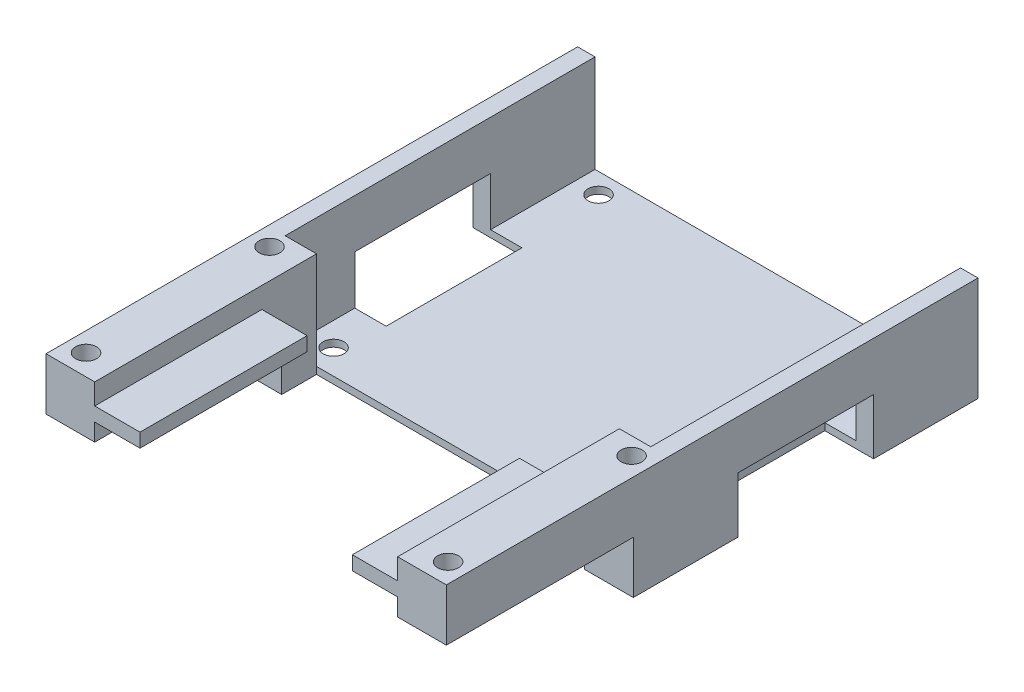
from build123d import *

# Parameters (mm, degrees)
SKETCH1_W                = 52.5
SKETCH1_H                = 44.5
BOSS_EXTRUDE1_DEPTH      = 1
BOSS_EXTRUDE2_DEPTH      = 15
F_3_0_3_DIAMETER_HOLE1_D = 3
SKETCH6_W                = 6.5
SKETCH6_H                = 2
BOSS_EXTRUDE3_DEPTH      = 24
SKETCH6_4_W              = 7
SKETCH6_4_H              = 7.5
CUT_EXTRUDE1_DEPTH       = 26.85
SKETCH8_W                = 7
SKETCH8_H                = 19.5
CUT_EXTRUDE2_DEPTH       = 8
CUT_EXTRUDE3_DEPTH       = 0.3


with BuildPart() as part:
    # Sketch1 → Boss-Extrude1 (new body)
    with BuildSketch(Plane(origin=(0, 0, 0), x_dir=(1, 0, 0), z_dir=(0, 1, 0))):
        with Locations((0, 54.1)):
            Rectangle(SKETCH1_W, SKETCH1_H)
    extrude(amount=BOSS_EXTRUDE1_DEPTH)

    # Sketch1<3> → Boss-Extrude2 (add)
    with BuildSketch(Plane(origin=(0, 0, 0), x_dir=(1, 0, 0), z_dir=(0, 1, 0))):
        Polygon((-26.25, 76.35), (-28.75, 76.35), (-28.75, 0), (-21.75, 0), (-21.75, 31.85), (-26.25, 31.85), align=None)
        Polygon((28.75, 76.35), (26.25, 76.35), (26.25, 31.85), (21.75, 31.85), (21.75, 0), (28.75, 0), align=None)
    extrude(amount=BOSS_EXTRUDE2_DEPTH)

    # Ø3.0 (3) Diameter Hole1 (through all)
    with Locations(Plane(origin=(0, 0, 0), x_dir=(-1, 0, 0), z_dir=(0, -1, 0))):
        with Locations((-22.85, 73.45), (22.85, 73.45), (26, 29.35), (22.85, 35.4), (-22.85, 35.4), (-26, 29.35), (-26, 3), (26, 3), (-30.25, 71.35), (30.25, 71.35)):
            Hole(F_3_0_3_DIAMETER_HOLE1_D / 2)

    # Sketch6 → Boss-Extrude3 (add)
    with BuildSketch(Plane.XY):
        with Locations((-18.5, 11)):
            Rectangle(SKETCH6_W, SKETCH6_H)
        with Locations((18.5, 11)):
            Rectangle(SKETCH6_W, SKETCH6_H)
    extrude(amount=-BOSS_EXTRUDE3_DEPTH)

    # Sketch6<4> → Cut-Extrude1 (cut)
    with BuildSketch(Plane.XY):
        with Locations((-25.25, 3.75)):
            Rectangle(SKETCH6_4_W, SKETCH6_4_H)
        with Locations((25.25, 3.75)):
            Rectangle(SKETCH6_4_W, SKETCH6_4_H)
    extrude(amount=-CUT_EXTRUDE1_DEPTH, mode=Mode.SUBTRACT)

    # Sketch8 → Cut-Extrude2 (cut)
    with BuildSketch(Plane.XZ):
        with Locations((-25.25, -51.6)):
            Rectangle(SKETCH8_W, SKETCH8_H)
        with Locations((25.25, -51.6)):
            Rectangle(SKETCH8_W, SKETCH8_H)
    extrude(amount=-CUT_EXTRUDE2_DEPTH, mode=Mode.SUBTRACT)

    # Sketch9 → Cut-Extrude3 (cut)
    with BuildSketch(Plane.XZ):
        Polygon((-3.689843301, -66.963585904), (-0.766939618, -56.191794443), (-9.599348257, -56.191794443), (4.207929605, -40.061796941), (3.001024061, -51.044637389), (10.995078197, -51.044637389), align=None)
    extrude(amount=-CUT_EXTRUDE3_DEPTH, mode=Mode.SUBTRACT)


solid = part.part
